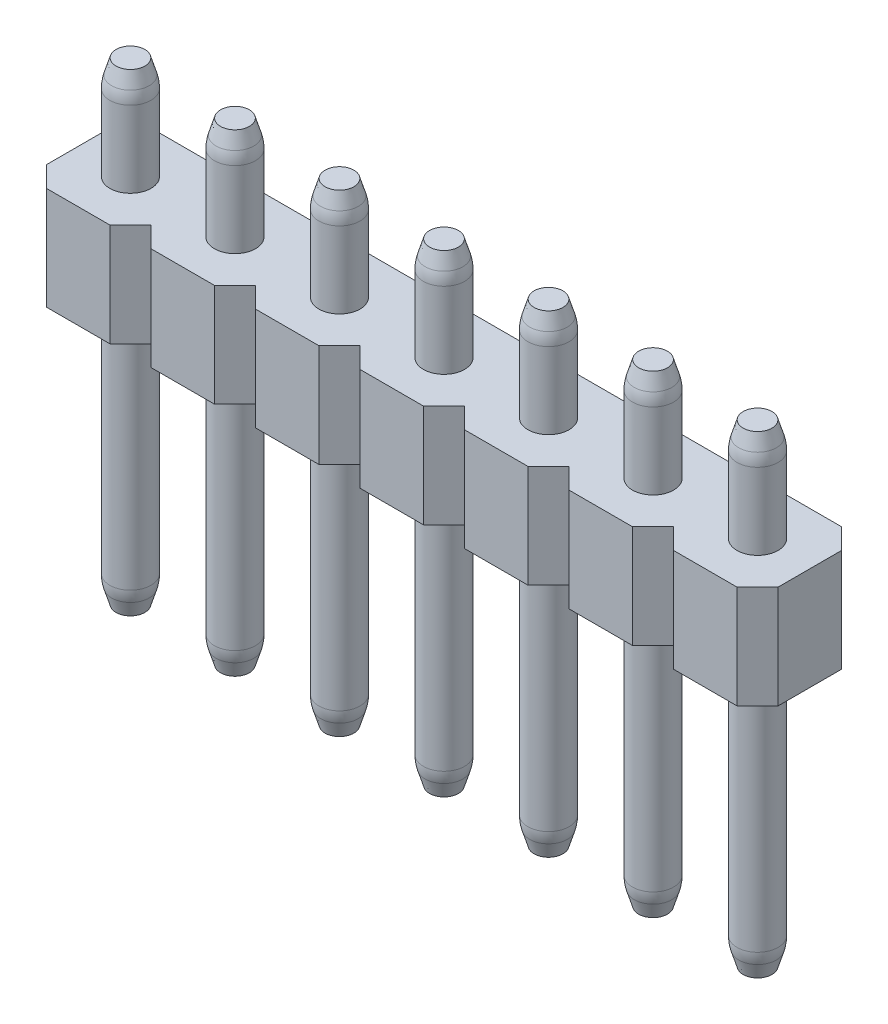
from build123d import *
from OCP.BRepFilletAPI import BRepFilletAPI_MakeChamfer

# Parameters (mm, degrees)
SKETCH1_R               = 0.5
BOSS_EXTRUDE1_DEPTH     = 11.5
BOSS_EXTRUDE1_2_DEPTH   = 11.5
BOSS_EXTRUDE1_3_DEPTH   = 11.5
BOSS_EXTRUDE1_4_DEPTH   = 11.5
BOSS_EXTRUDE1_5_DEPTH   = 11.5
BOSS_EXTRUDE1_6_DEPTH   = 11.5
BOSS_EXTRUDE1_7_DEPTH   = 11.5
BOSS_EXTRUDE1_8_DEPTH   = 11.5
BOSS_EXTRUDE1_9_DEPTH   = 11.5
BOSS_EXTRUDE1_10_DEPTH  = 11.5
BOSS_EXTRUDE1_11_DEPTH  = 11.5
BOSS_EXTRUDE1_12_DEPTH  = 11.5
BOSS_EXTRUDE1_13_DEPTH  = 11.5
BOSS_EXTRUDE1_14_DEPTH  = 11.5
BOSS_EXTRUDE1_15_DEPTH  = 11.5
BOSS_EXTRUDE1_16_DEPTH  = 11.5
BOSS_EXTRUDE2_DEPTH     = 2.5
CHAMFER1_SIZE           = 0.5
CHAMFER1_SIZE2          = 0.15
FILLET1_R               = 1
CHAMFER2_SIZE           = 0.15
CHAMFER2_SIZE2          = 0.5
FILLET2_R               = 1
CUT_EXTRUDE1_DEPTH      = 42.093776929
CUT_EXTRUDE1_DEPTH_BACK = 42.093776929
SKETCH3_W               = 22.86
SKETCH3_H               = 11.5


with BuildPart() as part:
    # Sketch1 → Boss-Extrude1 (new body)
    with BuildSketch(Plane(origin=(0, 0, 0), x_dir=(1, 0, 0), z_dir=(0, 1, 0))):
        Circle(SKETCH1_R)
    extrude(amount=BOSS_EXTRUDE1_DEPTH)



with BuildPart() as body_2:
    # Sketch1 → Boss-Extrude1 2 (new body)
    with BuildSketch(Plane(origin=(0, 0, 0), x_dir=(1, 0, 0), z_dir=(0, 1, 0))):
        with Locations((2.54, 0)):
            Circle(SKETCH1_R)
    extrude(amount=BOSS_EXTRUDE1_2_DEPTH)


with BuildPart() as body_3:
    # Sketch1 → Boss-Extrude1 3 (new body)
    with BuildSketch(Plane(origin=(0, 0, 0), x_dir=(1, 0, 0), z_dir=(0, 1, 0))):
        with Locations((5.08, 0)):
            Circle(SKETCH1_R)
    extrude(amount=BOSS_EXTRUDE1_3_DEPTH)


with BuildPart() as body_4:
    # Sketch1 → Boss-Extrude1 4 (new body)
    with BuildSketch(Plane(origin=(0, 0, 0), x_dir=(1, 0, 0), z_dir=(0, 1, 0))):
        with Locations((7.62, 0)):
            Circle(SKETCH1_R)
    extrude(amount=BOSS_EXTRUDE1_4_DEPTH)


with BuildPart() as body_5:
    # Sketch1 → Boss-Extrude1 5 (new body)
    with BuildSketch(Plane(origin=(0, 0, 0), x_dir=(1, 0, 0), z_dir=(0, 1, 0))):
        with Locations((10.16, 0)):
            Circle(SKETCH1_R)
    extrude(amount=BOSS_EXTRUDE1_5_DEPTH)


with BuildPart() as body_6:
    # Sketch1 → Boss-Extrude1 6 (new body)
    with BuildSketch(Plane(origin=(0, 0, 0), x_dir=(1, 0, 0), z_dir=(0, 1, 0))):
        with Locations((12.7, 0)):
            Circle(SKETCH1_R)
    extrude(amount=BOSS_EXTRUDE1_6_DEPTH)


with BuildPart() as body_7:
    # Sketch1 → Boss-Extrude1 7 (new body)
    with BuildSketch(Plane(origin=(0, 0, 0), x_dir=(1, 0, 0), z_dir=(0, 1, 0))):
        with Locations((15.24, 0)):
            Circle(SKETCH1_R)
    extrude(amount=BOSS_EXTRUDE1_7_DEPTH)


with BuildPart() as body_8:
    # Sketch1 → Boss-Extrude1 8 (new body)
    with BuildSketch(Plane(origin=(0, 0, 0), x_dir=(1, 0, 0), z_dir=(0, 1, 0))):
        with Locations((17.78, 0)):
            Circle(SKETCH1_R)
    extrude(amount=BOSS_EXTRUDE1_8_DEPTH)


with BuildPart() as body_9:
    # Sketch1 → Boss-Extrude1 9 (new body)
    with BuildSketch(Plane(origin=(0, 0, 0), x_dir=(1, 0, 0), z_dir=(0, 1, 0))):
        with Locations((20.32, 0)):
            Circle(SKETCH1_R)
    extrude(amount=BOSS_EXTRUDE1_9_DEPTH)


with BuildPart() as body_10:
    # Sketch1 → Boss-Extrude1 10 (new body)
    with BuildSketch(Plane(origin=(0, 0, 0), x_dir=(1, 0, 0), z_dir=(0, 1, 0))):
        with Locations((22.86, 0)):
            Circle(SKETCH1_R)
    extrude(amount=BOSS_EXTRUDE1_10_DEPTH)


with BuildPart() as body_11:
    # Sketch1 → Boss-Extrude1 11 (new body)
    with BuildSketch(Plane(origin=(0, 0, 0), x_dir=(1, 0, 0), z_dir=(0, 1, 0))):
        with Locations((25.4, 0)):
            Circle(SKETCH1_R)
    extrude(amount=BOSS_EXTRUDE1_11_DEPTH)


with BuildPart() as body_12:
    # Sketch1 → Boss-Extrude1 12 (new body)
    with BuildSketch(Plane(origin=(0, 0, 0), x_dir=(1, 0, 0), z_dir=(0, 1, 0))):
        with Locations((27.94, 0)):
            Circle(SKETCH1_R)
    extrude(amount=BOSS_EXTRUDE1_12_DEPTH)


with BuildPart() as body_13:
    # Sketch1 → Boss-Extrude1 13 (new body)
    with BuildSketch(Plane(origin=(0, 0, 0), x_dir=(1, 0, 0), z_dir=(0, 1, 0))):
        with Locations((30.48, 0)):
            Circle(SKETCH1_R)
    extrude(amount=BOSS_EXTRUDE1_13_DEPTH)


with BuildPart() as body_14:
    # Sketch1 → Boss-Extrude1 14 (new body)
    with BuildSketch(Plane(origin=(0, 0, 0), x_dir=(1, 0, 0), z_dir=(0, 1, 0))):
        with Locations((33.02, 0)):
            Circle(SKETCH1_R)
    extrude(amount=BOSS_EXTRUDE1_14_DEPTH)


with BuildPart() as body_15:
    # Sketch1 → Boss-Extrude1 15 (new body)
    with BuildSketch(Plane(origin=(0, 0, 0), x_dir=(1, 0, 0), z_dir=(0, 1, 0))):
        with Locations((35.56, 0)):
            Circle(SKETCH1_R)
    extrude(amount=BOSS_EXTRUDE1_15_DEPTH)


with BuildPart() as body_16:
    # Sketch1 → Boss-Extrude1 16 (new body)
    with BuildSketch(Plane(origin=(0, 0, 0), x_dir=(1, 0, 0), z_dir=(0, 1, 0))):
        with Locations((38.1, 0)):
            Circle(SKETCH1_R)
    extrude(amount=BOSS_EXTRUDE1_16_DEPTH)


with BuildPart() as part_1:
    add(part.part)

    add(body_2.part)  # Boss-Extrude2 merges body 2

    add(body_3.part)  # Boss-Extrude2 merges body 3

    add(body_4.part)  # Boss-Extrude2 merges body 4

    add(body_5.part)  # Boss-Extrude2 merges body 5

    add(body_6.part)  # Boss-Extrude2 merges body 6

    add(body_7.part)  # Boss-Extrude2 merges body 7

    add(body_8.part)  # Boss-Extrude2 merges body 8

    add(body_9.part)  # Boss-Extrude2 merges body 9

    add(body_10.part)  # Boss-Extrude2 merges body 10

    add(body_11.part)  # Boss-Extrude2 merges body 11

    add(body_12.part)  # Boss-Extrude2 merges body 12

    add(body_13.part)  # Boss-Extrude2 merges body 13

    add(body_14.part)  # Boss-Extrude2 merges body 14

    add(body_15.part)  # Boss-Extrude2 merges body 15

    add(body_16.part)  # Boss-Extrude2 merges body 16
    # Sketch2 → Boss-Extrude2 (add)
    with BuildSketch(Plane(origin=(0, 6.5, 0), x_dir=(1, 0, 0), z_dir=(0, 1, 0))):
        Polygon((-1.27, 0.77), (-0.77, 1.27), (0.77, 1.27), (1.27, 0.77), (1.77, 1.27), (3.31, 1.27), (3.81, 0.77), (4.31, 1.27), (5.85, 1.27), (6.35, 0.77), (6.85, 1.27), (8.39, 1.27), (8.89, 0.77), (9.39, 1.27), (10.93, 1.27), (11.43, 0.77), (11.93, 1.27), (13.47, 1.27), (13.97, 0.77), (14.47, 1.27), (16.01, 1.27), (16.51, 0.77), (17.01, 1.27), (18.55, 1.27), (19.05, 0.77), (19.55, 1.27), (21.09, 1.27), (21.59, 0.77), (22.09, 1.27), (23.63, 1.27), (24.13, 0.77), (24.63, 1.27), (26.17, 1.27), (26.67, 0.77), (27.17, 1.27), (28.71, 1.27), (29.21, 0.77), (29.71, 1.27), (31.25, 1.27), (31.75, 0.77), (32.25, 1.27), (33.79, 1.27), (34.29, 0.77), (34.79, 1.27), (36.33, 1.27), (36.83, 0.77), (37.33, 1.27), (38.87, 1.27), (39.37, 0.77), (39.37, -0.77), (38.87, -1.27), (37.33, -1.27), (36.83, -0.77), (36.33, -1.27), (34.79, -1.27), (34.29, -0.77), (33.79, -1.27), (32.25, -1.27), (31.75, -0.77), (31.25, -1.27), (29.71, -1.27), (29.21, -0.77), (28.71, -1.27), (27.17, -1.27), (26.67, -0.77), (26.17, -1.27), (24.63, -1.27), (24.13, -0.77), (23.63, -1.27), (22.09, -1.27), (21.59, -0.77), (21.09, -1.27), (19.55, -1.27), (19.05, -0.77), (18.55, -1.27), (17.01, -1.27), (16.51, -0.77), (16.01, -1.27), (14.47, -1.27), (13.97, -0.77), (13.47, -1.27), (11.93, -1.27), (11.43, -0.77), (10.93, -1.27), (9.39, -1.27), (8.89, -0.77), (8.39, -1.27), (6.85, -1.27), (6.35, -0.77), (5.85, -1.27), (4.31, -1.27), (3.81, -0.77), (3.31, -1.27), (1.77, -1.27), (1.27, -0.77), (0.77, -1.27), (-0.77, -1.27), (-1.27, -0.77), align=None)
    extrude(amount=BOSS_EXTRUDE2_DEPTH)

    # Chamfer1: one chamfer whose edges measure the first distance from different faces: ONE call of the kernel's chamfer builder (chamfer() names one face for all edges)
    chamfer1_edges_1 = [part_1.edges().sort_by_distance(p)[0] for p in [
        (14.74, 11.5, 0),
    ]]
    chamfer1_side_1 = [part_1.faces().sort_by_distance(p)[0] for p in [
        (14.74, 10.25, 0),
    ]]
    chamfer1_edges_2 = [part_1.edges().sort_by_distance(p)[0] for p in [
        (12.2, 11.5, 0),
    ]]
    chamfer1_side_2 = [part_1.faces().sort_by_distance(p)[0] for p in [
        (12.2, 10.25, 0),
    ]]
    chamfer1_edges_3 = [part_1.edges().sort_by_distance(p)[0] for p in [
        (9.66, 11.5, 0),
    ]]
    chamfer1_side_3 = [part_1.faces().sort_by_distance(p)[0] for p in [
        (9.66, 10.25, 0),
    ]]
    chamfer1_edges_4 = [part_1.edges().sort_by_distance(p)[0] for p in [
        (7.12, 11.5, 0),
    ]]
    chamfer1_side_4 = [part_1.faces().sort_by_distance(p)[0] for p in [
        (7.12, 10.25, 0),
    ]]
    chamfer1_edges_5 = [part_1.edges().sort_by_distance(p)[0] for p in [
        (4.58, 11.5, 0),
    ]]
    chamfer1_side_5 = [part_1.faces().sort_by_distance(p)[0] for p in [
        (4.58, 10.25, 0),
    ]]
    chamfer1_edges_6 = [part_1.edges().sort_by_distance(p)[0] for p in [
        (2.04, 11.5, 0),
    ]]
    chamfer1_side_6 = [part_1.faces().sort_by_distance(p)[0] for p in [
        (2.04, 10.25, 0),
    ]]
    chamfer1_edges_7 = [part_1.edges().sort_by_distance(p)[0] for p in [
        (-0.5, 11.5, 0),
    ]]
    chamfer1_side_7 = [part_1.faces().sort_by_distance(p)[0] for p in [
        (-0.5, 10.25, 0),
    ]]
    chamfer1_edges_8 = [part_1.edges().sort_by_distance(p)[0] for p in [
        (37.6, 11.5, 0),
    ]]
    chamfer1_side_8 = [part_1.faces().sort_by_distance(p)[0] for p in [
        (37.6, 10.25, 0),
    ]]
    chamfer1_edges_9 = [part_1.edges().sort_by_distance(p)[0] for p in [
        (35.06, 11.5, 0),
    ]]
    chamfer1_side_9 = [part_1.faces().sort_by_distance(p)[0] for p in [
        (35.06, 10.25, 0),
    ]]
    chamfer1_edges_10 = [part_1.edges().sort_by_distance(p)[0] for p in [
        (32.52, 11.5, 0),
    ]]
    chamfer1_side_10 = [part_1.faces().sort_by_distance(p)[0] for p in [
        (32.52, 10.25, 0),
    ]]
    chamfer1_edges_11 = [part_1.edges().sort_by_distance(p)[0] for p in [
        (29.98, 11.5, 0),
    ]]
    chamfer1_side_11 = [part_1.faces().sort_by_distance(p)[0] for p in [
        (29.98, 10.25, 0),
    ]]
    chamfer1_edges_12 = [part_1.edges().sort_by_distance(p)[0] for p in [
        (27.44, 11.5, 0),
    ]]
    chamfer1_side_12 = [part_1.faces().sort_by_distance(p)[0] for p in [
        (27.44, 10.25, 0),
    ]]
    chamfer1_edges_13 = [part_1.edges().sort_by_distance(p)[0] for p in [
        (24.9, 11.5, 0),
    ]]
    chamfer1_side_13 = [part_1.faces().sort_by_distance(p)[0] for p in [
        (24.9, 10.25, 0),
    ]]
    chamfer1_edges_14 = [part_1.edges().sort_by_distance(p)[0] for p in [
        (22.36, 11.5, 0),
    ]]
    chamfer1_side_14 = [part_1.faces().sort_by_distance(p)[0] for p in [
        (22.36, 10.25, 0),
    ]]
    chamfer1_edges_15 = [part_1.edges().sort_by_distance(p)[0] for p in [
        (19.82, 11.5, 0),
    ]]
    chamfer1_side_15 = [part_1.faces().sort_by_distance(p)[0] for p in [
        (19.82, 10.25, 0),
    ]]
    chamfer1_edges_16 = [part_1.edges().sort_by_distance(p)[0] for p in [
        (17.28, 11.5, 0),
    ]]
    chamfer1_side_16 = [part_1.faces().sort_by_distance(p)[0] for p in [
        (17.28, 10.25, 0),
    ]]
    chamfer1 = BRepFilletAPI_MakeChamfer(part_1.part.solid().wrapped)
    for e in chamfer1_edges_1:
        chamfer1.Add(CHAMFER1_SIZE, CHAMFER1_SIZE2, e.wrapped, chamfer1_side_1[0].wrapped)  # the first distance lies on this face
    for e in chamfer1_edges_2:
        chamfer1.Add(CHAMFER1_SIZE, CHAMFER1_SIZE2, e.wrapped, chamfer1_side_2[0].wrapped)  # the first distance lies on this face
    for e in chamfer1_edges_3:
        chamfer1.Add(CHAMFER1_SIZE, CHAMFER1_SIZE2, e.wrapped, chamfer1_side_3[0].wrapped)  # the first distance lies on this face
    for e in chamfer1_edges_4:
        chamfer1.Add(CHAMFER1_SIZE, CHAMFER1_SIZE2, e.wrapped, chamfer1_side_4[0].wrapped)  # the first distance lies on this face
    for e in chamfer1_edges_5:
        chamfer1.Add(CHAMFER1_SIZE, CHAMFER1_SIZE2, e.wrapped, chamfer1_side_5[0].wrapped)  # the first distance lies on this face
    for e in chamfer1_edges_6:
        chamfer1.Add(CHAMFER1_SIZE, CHAMFER1_SIZE2, e.wrapped, chamfer1_side_6[0].wrapped)  # the first distance lies on this face
    for e in chamfer1_edges_7:
        chamfer1.Add(CHAMFER1_SIZE, CHAMFER1_SIZE2, e.wrapped, chamfer1_side_7[0].wrapped)  # the first distance lies on this face
    for e in chamfer1_edges_8:
        chamfer1.Add(CHAMFER1_SIZE, CHAMFER1_SIZE2, e.wrapped, chamfer1_side_8[0].wrapped)  # the first distance lies on this face
    for e in chamfer1_edges_9:
        chamfer1.Add(CHAMFER1_SIZE, CHAMFER1_SIZE2, e.wrapped, chamfer1_side_9[0].wrapped)  # the first distance lies on this face
    for e in chamfer1_edges_10:
        chamfer1.Add(CHAMFER1_SIZE, CHAMFER1_SIZE2, e.wrapped, chamfer1_side_10[0].wrapped)  # the first distance lies on this face
    for e in chamfer1_edges_11:
        chamfer1.Add(CHAMFER1_SIZE, CHAMFER1_SIZE2, e.wrapped, chamfer1_side_11[0].wrapped)  # the first distance lies on this face
    for e in chamfer1_edges_12:
        chamfer1.Add(CHAMFER1_SIZE, CHAMFER1_SIZE2, e.wrapped, chamfer1_side_12[0].wrapped)  # the first distance lies on this face
    for e in chamfer1_edges_13:
        chamfer1.Add(CHAMFER1_SIZE, CHAMFER1_SIZE2, e.wrapped, chamfer1_side_13[0].wrapped)  # the first distance lies on this face
    for e in chamfer1_edges_14:
        chamfer1.Add(CHAMFER1_SIZE, CHAMFER1_SIZE2, e.wrapped, chamfer1_side_14[0].wrapped)  # the first distance lies on this face
    for e in chamfer1_edges_15:
        chamfer1.Add(CHAMFER1_SIZE, CHAMFER1_SIZE2, e.wrapped, chamfer1_side_15[0].wrapped)  # the first distance lies on this face
    for e in chamfer1_edges_16:
        chamfer1.Add(CHAMFER1_SIZE, CHAMFER1_SIZE2, e.wrapped, chamfer1_side_16[0].wrapped)  # the first distance lies on this face
    add(Compound.cast(chamfer1.Shape()), mode=Mode.REPLACE)

    # Fillet1
    fillet1_edges = [part_1.edges().sort_by_distance(p)[0] for p in [
        (37.6, 11, 0),
        (35.06, 11, 0),
        (32.52, 11, 0),
        (29.98, 11, 0),
        (27.44, 11, 0),
        (24.9, 11, 0),
        (22.36, 11, 0),
        (19.82, 11, 0),
        (17.28, 11, 0),
        (14.74, 11, 0),
        (12.2, 11, 0),
        (9.66, 11, 0),
        (7.12, 11, 0),
        (4.58, 11, 0),
        (2.04, 11, 0),
        (-0.5, 11, 0),
    ]]
    fillet(fillet1_edges, radius=FILLET1_R)

    # Chamfer2: one chamfer whose edges measure the first distance from different faces: ONE call of the kernel's chamfer builder (chamfer() names one face for all edges)
    chamfer2_edges_1 = [part_1.edges().sort_by_distance(p)[0] for p in [
        (9.66, 0, 0),
    ]]
    chamfer2_side_1 = [part_1.faces().sort_by_distance(p)[0] for p in [
        (10.16, 0, 0),
    ]]
    chamfer2_edges_2 = [part_1.edges().sort_by_distance(p)[0] for p in [
        (17.28, 0, 0),
    ]]
    chamfer2_side_2 = [part_1.faces().sort_by_distance(p)[0] for p in [
        (17.78, 0, 0),
    ]]
    chamfer2_edges_3 = [part_1.edges().sort_by_distance(p)[0] for p in [
        (22.36, 0, 0),
    ]]
    chamfer2_side_3 = [part_1.faces().sort_by_distance(p)[0] for p in [
        (22.86, 0, 0),
    ]]
    chamfer2_edges_4 = [part_1.edges().sort_by_distance(p)[0] for p in [
        (27.44, 0, 0),
    ]]
    chamfer2_side_4 = [part_1.faces().sort_by_distance(p)[0] for p in [
        (27.94, 0, 0),
    ]]
    chamfer2_edges_5 = [part_1.edges().sort_by_distance(p)[0] for p in [
        (29.98, 0, 0),
    ]]
    chamfer2_side_5 = [part_1.faces().sort_by_distance(p)[0] for p in [
        (30.48, 0, 0),
    ]]
    chamfer2_edges_6 = [part_1.edges().sort_by_distance(p)[0] for p in [
        (-0.5, 0, 0),
    ]]
    chamfer2_side_6 = [part_1.faces().sort_by_distance(p)[0] for p in [
        (0, 0, 0),
    ]]
    chamfer2_edges_7 = [part_1.edges().sort_by_distance(p)[0] for p in [
        (2.04, 0, 0),
    ]]
    chamfer2_side_7 = [part_1.faces().sort_by_distance(p)[0] for p in [
        (2.54, 0, 0),
    ]]
    chamfer2_edges_8 = [part_1.edges().sort_by_distance(p)[0] for p in [
        (4.58, 0, 0),
    ]]
    chamfer2_side_8 = [part_1.faces().sort_by_distance(p)[0] for p in [
        (5.08, 0, 0),
    ]]
    chamfer2_edges_9 = [part_1.edges().sort_by_distance(p)[0] for p in [
        (7.12, 0, 0),
    ]]
    chamfer2_side_9 = [part_1.faces().sort_by_distance(p)[0] for p in [
        (7.62, 0, 0),
    ]]
    chamfer2_edges_10 = [part_1.edges().sort_by_distance(p)[0] for p in [
        (12.2, 0, 0),
    ]]
    chamfer2_side_10 = [part_1.faces().sort_by_distance(p)[0] for p in [
        (12.7, 0, 0),
    ]]
    chamfer2_edges_11 = [part_1.edges().sort_by_distance(p)[0] for p in [
        (14.74, 0, 0),
    ]]
    chamfer2_side_11 = [part_1.faces().sort_by_distance(p)[0] for p in [
        (15.24, 0, 0),
    ]]
    chamfer2_edges_12 = [part_1.edges().sort_by_distance(p)[0] for p in [
        (19.82, 0, 0),
    ]]
    chamfer2_side_12 = [part_1.faces().sort_by_distance(p)[0] for p in [
        (20.32, 0, 0),
    ]]
    chamfer2_edges_13 = [part_1.edges().sort_by_distance(p)[0] for p in [
        (24.9, 0, 0),
    ]]
    chamfer2_side_13 = [part_1.faces().sort_by_distance(p)[0] for p in [
        (25.4, 0, 0),
    ]]
    chamfer2_edges_14 = [part_1.edges().sort_by_distance(p)[0] for p in [
        (32.52, 0, 0),
    ]]
    chamfer2_side_14 = [part_1.faces().sort_by_distance(p)[0] for p in [
        (33.02, 0, 0),
    ]]
    chamfer2_edges_15 = [part_1.edges().sort_by_distance(p)[0] for p in [
        (35.06, 0, 0),
    ]]
    chamfer2_side_15 = [part_1.faces().sort_by_distance(p)[0] for p in [
        (35.56, 0, 0),
    ]]
    chamfer2_edges_16 = [part_1.edges().sort_by_distance(p)[0] for p in [
        (37.6, 0, 0),
    ]]
    chamfer2_side_16 = [part_1.faces().sort_by_distance(p)[0] for p in [
        (38.1, 0, 0),
    ]]
    chamfer2 = BRepFilletAPI_MakeChamfer(part_1.part.solid().wrapped)
    for e in chamfer2_edges_1:
        chamfer2.Add(CHAMFER2_SIZE, CHAMFER2_SIZE2, e.wrapped, chamfer2_side_1[0].wrapped)  # the first distance lies on this face
    for e in chamfer2_edges_2:
        chamfer2.Add(CHAMFER2_SIZE, CHAMFER2_SIZE2, e.wrapped, chamfer2_side_2[0].wrapped)  # the first distance lies on this face
    for e in chamfer2_edges_3:
        chamfer2.Add(CHAMFER2_SIZE, CHAMFER2_SIZE2, e.wrapped, chamfer2_side_3[0].wrapped)  # the first distance lies on this face
    for e in chamfer2_edges_4:
        chamfer2.Add(CHAMFER2_SIZE, CHAMFER2_SIZE2, e.wrapped, chamfer2_side_4[0].wrapped)  # the first distance lies on this face
    for e in chamfer2_edges_5:
        chamfer2.Add(CHAMFER2_SIZE, CHAMFER2_SIZE2, e.wrapped, chamfer2_side_5[0].wrapped)  # the first distance lies on this face
    for e in chamfer2_edges_6:
        chamfer2.Add(CHAMFER2_SIZE, CHAMFER2_SIZE2, e.wrapped, chamfer2_side_6[0].wrapped)  # the first distance lies on this face
    for e in chamfer2_edges_7:
        chamfer2.Add(CHAMFER2_SIZE, CHAMFER2_SIZE2, e.wrapped, chamfer2_side_7[0].wrapped)  # the first distance lies on this face
    for e in chamfer2_edges_8:
        chamfer2.Add(CHAMFER2_SIZE, CHAMFER2_SIZE2, e.wrapped, chamfer2_side_8[0].wrapped)  # the first distance lies on this face
    for e in chamfer2_edges_9:
        chamfer2.Add(CHAMFER2_SIZE, CHAMFER2_SIZE2, e.wrapped, chamfer2_side_9[0].wrapped)  # the first distance lies on this face
    for e in chamfer2_edges_10:
        chamfer2.Add(CHAMFER2_SIZE, CHAMFER2_SIZE2, e.wrapped, chamfer2_side_10[0].wrapped)  # the first distance lies on this face
    for e in chamfer2_edges_11:
        chamfer2.Add(CHAMFER2_SIZE, CHAMFER2_SIZE2, e.wrapped, chamfer2_side_11[0].wrapped)  # the first distance lies on this face
    for e in chamfer2_edges_12:
        chamfer2.Add(CHAMFER2_SIZE, CHAMFER2_SIZE2, e.wrapped, chamfer2_side_12[0].wrapped)  # the first distance lies on this face
    for e in chamfer2_edges_13:
        chamfer2.Add(CHAMFER2_SIZE, CHAMFER2_SIZE2, e.wrapped, chamfer2_side_13[0].wrapped)  # the first distance lies on this face
    for e in chamfer2_edges_14:
        chamfer2.Add(CHAMFER2_SIZE, CHAMFER2_SIZE2, e.wrapped, chamfer2_side_14[0].wrapped)  # the first distance lies on this face
    for e in chamfer2_edges_15:
        chamfer2.Add(CHAMFER2_SIZE, CHAMFER2_SIZE2, e.wrapped, chamfer2_side_15[0].wrapped)  # the first distance lies on this face
    for e in chamfer2_edges_16:
        chamfer2.Add(CHAMFER2_SIZE, CHAMFER2_SIZE2, e.wrapped, chamfer2_side_16[0].wrapped)  # the first distance lies on this face
    add(Compound.cast(chamfer2.Shape()), mode=Mode.REPLACE)

    # Fillet2
    fillet2_edges = [part_1.edges().sort_by_distance(p)[0] for p in [
        (29.98, 0.5, 0),
        (32.52, 0.5, 0),
        (35.06, 0.5, 0),
        (37.6, 0.5, 0),
        (27.44, 0.5, 0),
        (24.9, 0.5, 0),
        (22.36, 0.5, 0),
        (19.82, 0.5, 0),
        (17.28, 0.5, 0),
        (14.74, 0.5, 0),
        (12.2, 0.5, 0),
        (9.66, 0.5, 0),
        (7.12, 0.5, 0),
        (4.58, 0.5, 0),
        (2.04, 0.5, 0),
        (-0.5, 0.5, 0),
    ]]
    fillet(fillet2_edges, radius=FILLET2_R)

    # Sketch3 → Cut-Extrude1 (cut, two sides: drawn at the far end of the back side and taken through both)
    with BuildSketch(Plane.XY.offset(1.27).offset(-CUT_EXTRUDE1_DEPTH_BACK)):
        with Locations((27.94, 5.75)):
            Rectangle(SKETCH3_W, SKETCH3_H)
    extrude(amount=CUT_EXTRUDE1_DEPTH + CUT_EXTRUDE1_DEPTH_BACK, mode=Mode.SUBTRACT)


solid = part_1.part
